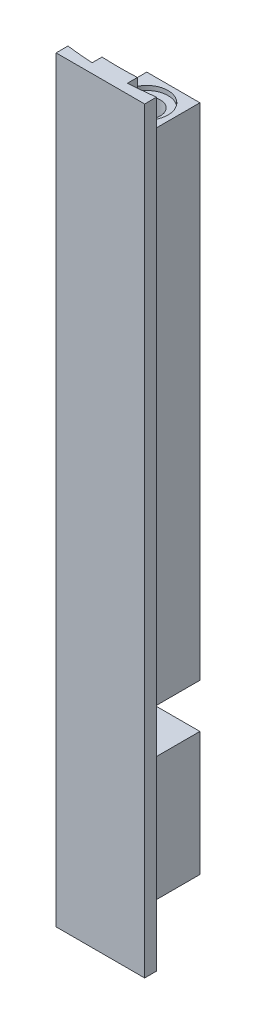
from build123d import *

# Parameters (mm, degrees)
BOSS_EXTRUDE2_DEPTH = 75.5
BOSS_EXTRUDE3_DEPTH = 85.5
SKETCH7_W           = 37.5
SKETCH7_H           = 5
SKETCH9_R           = 1.55
CUT_EXTRUDE4_DEPTH  = 4.3
SKETCH10_R          = 2.4
CUT_EXTRUDE5_DEPTH  = 0.5
SKETCH13_R          = 2.4
CUT_EXTRUDE6_DEPTH  = 0.5
SKETCH14_R          = 1.55
CUT_EXTRUDE7_DEPTH  = 4.3


with BuildPart() as part:
    # Sketch3 → Boss-Extrude2 (new body)
    with BuildSketch(Plane.XZ.offset(5)):
        with BuildLine():
            Line((-3, 37.379807383), (-3, 31.379807383))
            Line((-3, 31.379807383), (3, 31.379807383))
            Line((3, 31.379807383), (3, 37.379807383))
            ThreePointArc((3, 37.379807383), (0, 37.5), (-3, 37.379807383))
        make_face()
    extrude(amount=BOSS_EXTRUDE2_DEPTH)

    # Sketch5 → Boss-Extrude3 (add)
    with BuildSketch(Plane(origin=(0, 0, 0), x_dir=(1, 0, 0), z_dir=(0, 1, 0))):
        with BuildLine():
            Line((-5, -38.278473597), (-5, -39.236412732))
            Line((-5, -39.236412732), (-5, -39.621110463))
            Line((-5, -39.621110463), (0, -39.621110463))
            Line((0, -39.621110463), (5, -39.621110463))
            Line((5, -39.621110463), (5, -39.28334957))
            Line((5, -39.28334957), (5, -38.278473597))
            ThreePointArc((5, -38.278473597), (3.502667746, -38.444412593), (2.00000116, -38.551803282))
            Line((2.00000116, -38.551803282), (2.00000116, -37.431803282))
            ThreePointArc((2.00000116, -37.431803282), (0, -37.485195766), (-2.00000116, -37.431803282))
            Line((-2.00000116, -37.431803282), (-2.00000116, -38.551803282))
            ThreePointArc((-2.00000116, -38.551803282), (-3.502667746, -38.444412593), (-5, -38.278473597))
        make_face()
    extrude(amount=-BOSS_EXTRUDE3_DEPTH)

    # Sketch7 → Cut-Revolve1 (revolve, cut)
    with BuildSketch(Plane(origin=(0, 0, 0), x_dir=(0, 0, -1), z_dir=(1, 0, 0))):
        with Locations((-18.75, -64)):
            Rectangle(SKETCH7_W, SKETCH7_H)
    revolve(axis=Axis((0, -27.016689378, 0), (0, -1, 0)), mode=Mode.SUBTRACT)

    # Sketch9 → Cut-Extrude4 (cut)
    with BuildSketch(Plane(origin=(0, -80.5, 0), x_dir=(-1, 0, 0), z_dir=(0, -1, 0))):
        with Locations((0, -34.420864201)):
            Circle(SKETCH9_R)
    extrude(amount=-CUT_EXTRUDE4_DEPTH, mode=Mode.SUBTRACT)

    # Sketch10 → Cut-Extrude5 (cut)
    with BuildSketch(Plane(origin=(0, -80.5, 0), x_dir=(-1, 0, 0), z_dir=(0, -1, 0))):
        with Locations((0, -34.420864201)):
            Circle(SKETCH10_R)
    extrude(amount=-CUT_EXTRUDE5_DEPTH, mode=Mode.SUBTRACT)

    # Sketch13 → Cut-Extrude6 (cut)
    with BuildSketch(Plane(origin=(0, -5, 0), x_dir=(-1, 0, 0), z_dir=(0, -1, 0))):
        with Locations((0, -34.379807383)):
            Circle(SKETCH13_R)
    extrude(amount=CUT_EXTRUDE6_DEPTH, mode=Mode.SUBTRACT)

    # Sketch14 → Cut-Extrude7 (cut)
    with BuildSketch(Plane(origin=(0, -5, 0), x_dir=(-1, 0, 0), z_dir=(0, -1, 0))):
        with Locations((0, -34.379807383)):
            Circle(SKETCH14_R)
    extrude(amount=CUT_EXTRUDE7_DEPTH, mode=Mode.SUBTRACT)


solid = part.part
